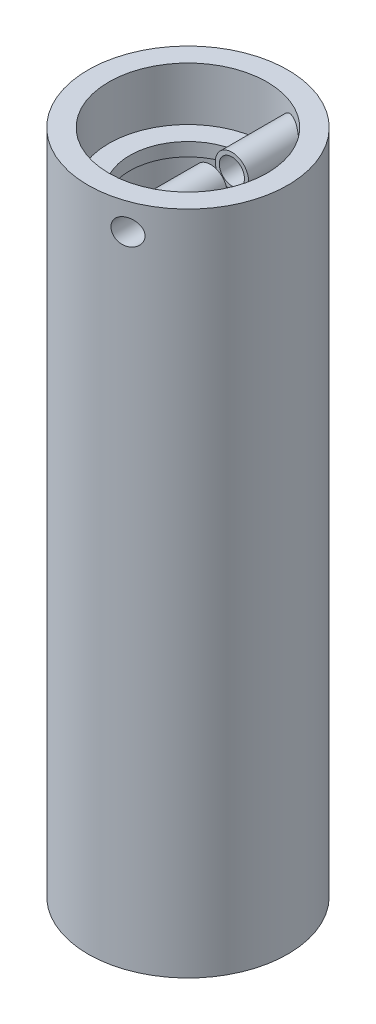
from build123d import *

# Parameters (mm, degrees)
SKETCH1_R                            = 19.05
BOSS_EXTRUDE1_DEPTH                  = 63.5
SKETCH2_R                            = 14.2875
CUT_EXTRUDE1_DEPTH                   = 114.3
SKETCH3_R                            = 11.1125
CUT_EXTRUDE3_DEPTH                   = 130.826056707
CUT_EXTRUDE5_DEPTH                   = 130.826056707
CUT_EXTRUDE5_DEPTH_BACK              = 10.16
SKETCH4_R                            = 15.08125
BOSS_EXTRUDE2_REACH                  = 70.979
BOSS_EXTRUDE2_END_RADIUS             = 15.08125
SKETCH6_R                            = 3.175
BOSS_EXTRUDE2_DIRECTION_2_REACH      = 70.979
BOSS_EXTRUDE2_DIRECTION_2_END_RADIUS = 15.08125
CUT_EXTRUDE6_DEPTH                   = 69.978656211
CUT_EXTRUDE6_DEPTH_BACK              = 69.978656211
SKETCH8_R                            = 2.4
CUT_EXTRUDE7_DEPTH                   = 130.826056834
CUT_EXTRUDE7_DEPTH_BACK              = 130.826056834
SKETCH9_W                            = 6.35
SKETCH9_H                            = 4.064


with BuildPart() as part:
    # Sketch1 → Boss-Extrude1 (new, symmetric)
    with BuildSketch(Plane(origin=(0, 0, 0), x_dir=(1, 0, 0), z_dir=(0, 1, 0))):
        Circle(SKETCH1_R)
    extrude(amount=BOSS_EXTRUDE1_DEPTH, both=True)

    # Sketch2 → Cut-Extrude1 (cut)
    with BuildSketch(Plane.XZ.offset(63.5)):
        Circle(SKETCH2_R)
    extrude(amount=-CUT_EXTRUDE1_DEPTH, mode=Mode.SUBTRACT)

    # Sketch3 → Cut-Extrude3 (cut, through all)
    with BuildSketch(Plane(origin=(0, 63.5, 0), x_dir=(1, 0, 0), z_dir=(0, 1, 0))):
        Circle(SKETCH3_R)
    extrude(amount=-CUT_EXTRUDE3_DEPTH, mode=Mode.SUBTRACT)

    # Sketch4 → Cut-Extrude5 (cut, two sides: drawn at the far end of the back side and taken through both)
    with BuildSketch(Plane(origin=(0, 63.5, 0), x_dir=(1, 0, 0), z_dir=(0, 1, 0)).offset(-CUT_EXTRUDE5_DEPTH_BACK)):
        Circle(SKETCH4_R)
    extrude(amount=CUT_EXTRUDE5_DEPTH + CUT_EXTRUDE5_DEPTH_BACK, mode=Mode.SUBTRACT)

    # Boss-Extrude2: up to this cylinder (the profile starts inside it)
    boss_extrude2_end = Plane(origin=(0, 58.42, 0), z_dir=(0, -1, 0)) * Cylinder(BOSS_EXTRUDE2_END_RADIUS, 173.1205, mode=Mode.PRIVATE)
    # Sketch6 → Boss-Extrude2 (add, up to the surface)
    with BuildSketch(Plane.XY, mode=Mode.PRIVATE) as boss_extrude2_sk1:
        with Locations((6.35, 58.42)):
            Circle(SKETCH6_R)
    boss_extrude2_tool1 = extrude(boss_extrude2_sk1.sketch, amount=BOSS_EXTRUDE2_REACH, mode=Mode.PRIVATE) & boss_extrude2_end
    add(boss_extrude2_tool1.solids().sort_by_distance((6.35, 58.42, 0))[0])

    # Boss-Extrude2 direction 2: up to this cylinder (the profile starts inside it)
    boss_extrude2_direction_2_end = Plane(origin=(0, 58.42, 0), z_dir=(0, -1, 0)) * Cylinder(BOSS_EXTRUDE2_DIRECTION_2_END_RADIUS, 173.1205, mode=Mode.PRIVATE)
    # Sketch6 → Boss-Extrude2 direction 2 (add, up to the surface)
    with BuildSketch(Plane.XY, mode=Mode.PRIVATE) as boss_extrude2_direction_2_sk1:
        with Locations((6.35, 58.42)):
            Circle(SKETCH6_R)
    boss_extrude2_direction_2_tool1 = extrude(boss_extrude2_direction_2_sk1.sketch, amount=-BOSS_EXTRUDE2_DIRECTION_2_REACH, mode=Mode.PRIVATE) & boss_extrude2_direction_2_end
    add(boss_extrude2_direction_2_tool1.solids().sort_by_distance((6.35, 58.42, 0))[0])

    # Sketch8 → Cut-Extrude6 (cut, two sides: drawn at the far end of the back side and taken through both)
    with BuildSketch(Plane.XY.offset(-CUT_EXTRUDE6_DEPTH_BACK)):
        with Locations((6.35, 58.42)):
            Circle(SKETCH8_R)
    extrude(amount=CUT_EXTRUDE6_DEPTH + CUT_EXTRUDE6_DEPTH_BACK, mode=Mode.SUBTRACT)

    # Sketch9 → Cut-Extrude7 (cut, two sides: drawn at the far end of the back side and taken through both)
    with BuildSketch(Plane(origin=(0, 63.5, 0), x_dir=(1, 0, 0), z_dir=(0, 1, 0)).offset(-CUT_EXTRUDE7_DEPTH_BACK)):
        with Locations((6.35, 0)):
            Rectangle(SKETCH9_W, SKETCH9_H)
    extrude(amount=CUT_EXTRUDE7_DEPTH + CUT_EXTRUDE7_DEPTH_BACK, mode=Mode.SUBTRACT)


solid = part.part
